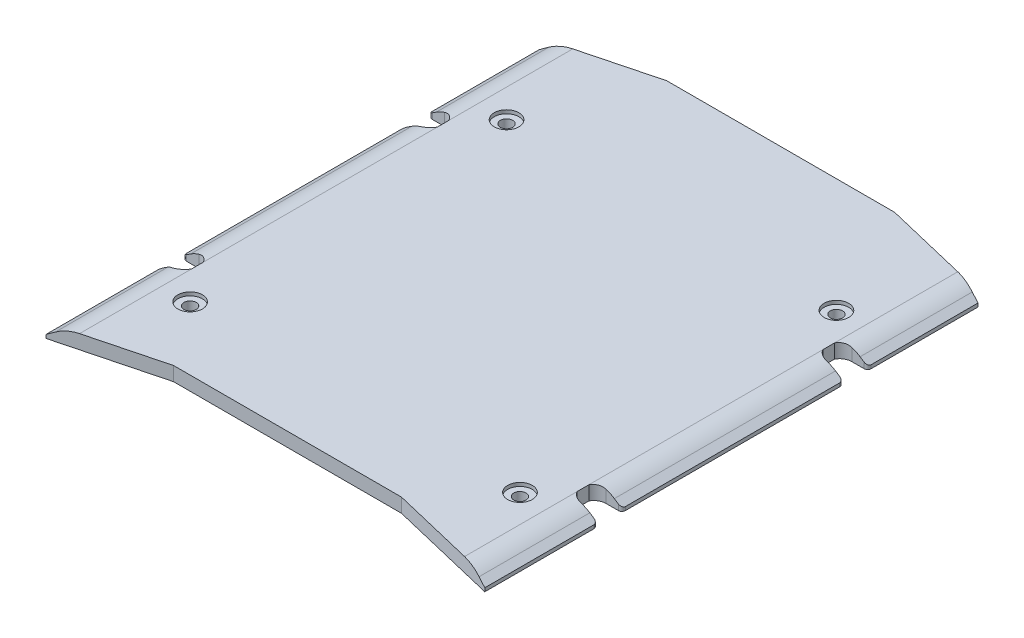
from build123d import *

# Parameters (mm, degrees)
BOSS_EXTRUDE1_DEPTH    = 148
FILLET1_R              = 10
CUT_EXTRUDE1_DEPTH     = 10
CUT_EXTRUDE2_START     = -4
CUT_EXTRUDE2_OUTLINE_R = 1.75
CUT_EXTRUDE2_DEPTH     = 4
SKETCH4_R              = 3.5
CUT_EXTRUDE3_DEPTH     = 1
FILLET2_R              = 1


# Read off the part's stored shape, not the designer's step: Cut-Extrude2
with BuildPart() as part:
    # Sketch1 → Boss-Extrude1 (new body)
    with BuildSketch(Plane.XY):
        Polygon((57.875, 15), (-57.875, 15), (-62.5, 12), (-62.5, 11), (62.5, 11), (62.5, 12), align=None)
    extrude(amount=BOSS_EXTRUDE1_DEPTH)

    # Fillet1
    fillet1_edges = [part.edges().sort_by_distance(p)[0] for p in [
        (-57.875, 15, 74),
        (57.875, 15, 74),
    ]]
    fillet(fillet1_edges, radius=FILLET1_R)

    # Sketch2 → Cut-Extrude1 (cut)
    with BuildSketch(Plane(origin=(0, 15, 0), x_dir=(1, 0, 0), z_dir=(0, 1, 0))):
        Polygon((-62.5, -7.5), (-33.66084425, 0), (31.256498232, 0), (62.5, -7.5), (62.5, 0), (31.256498232, 7.5), (-33.66084425, 7.5), (-62.5, 0), align=None)
        Polygon((31.256498232, -148), (62.5, -155.5), (62.5, -148), (31.256498232, -140.5), (-33.66084425, -140.5), (-62.5, -148), (-62.5, -155.5), (-33.66084425, -148), align=None)
    extrude(amount=-CUT_EXTRUDE1_DEPTH, mode=Mode.SUBTRACT)

    # Cut-Extrude2 outline → Cut-Extrude2 (cut)
    with BuildSketch(Plane(origin=(0, 15, 0), x_dir=(1, 0, 0), z_dir=(0, 1, 0)).offset(CUT_EXTRUDE2_START)):
        with BuildLine():
            Line((-62.5, -38.943696852), (-62.5, -45.943696852))
            Line((-62.5, -45.943696852), (-57.999999085, -45.943696852))
            ThreePointArc((-57.999999085, -45.943696852), (-56.202906175, -45.447104429), (-54.915769107, -44.098243751))
            Line((-54.915769107, -44.098243751), (-54.915769107, -40.789149953))
            ThreePointArc((-54.915769107, -40.789149953), (-56.202906175, -39.440289275), (-57.999999085, -38.943696852))
            Line((-57.999999085, -38.943696852), (-62.5, -38.943696852))
        make_face()
        with BuildLine():
            Line((-62.5, -115.432850877), (-59.820701756, -115.432850877))
            ThreePointArc((-59.820701756, -115.432850877), (-57.081076151, -115.820911776), (-54.915769107, -114.098243751))
            Line((-54.915769107, -114.098243751), (-54.915769107, -110.789149953))
            ThreePointArc((-54.915769107, -110.789149953), (-56.202906175, -109.440289275), (-57.999999085, -108.943696852))
            Line((-57.999999085, -108.943696852), (-62.5, -108.943696852))
            Line((-62.5, -108.943696852), (-62.5, -115.432850877))
        make_face()
        with BuildLine():
            Line((57.999999085, -45.943696852), (62.5, -45.943696852))
            Line((62.5, -45.943696852), (62.5, -38.943696852))
            Line((62.5, -38.943696852), (57.999999085, -38.943696852))
            ThreePointArc((57.999999085, -38.943696852), (56.202906175, -39.440289275), (54.915769107, -40.789149953))
            Line((54.915769107, -40.789149953), (54.915769107, -44.098243751))
            ThreePointArc((54.915769107, -44.098243751), (56.202906175, -45.447104429), (57.999999085, -45.943696852))
        make_face()
        with BuildLine():
            Line((62.5, -108.943696852), (57.999999085, -108.943696852))
            ThreePointArc((57.999999085, -108.943696852), (56.202906175, -109.440289275), (54.915769107, -110.789149953))
            Line((54.915769107, -110.789149953), (54.915769107, -114.098243751))
            ThreePointArc((54.915769107, -114.098243751), (56.202906175, -115.447104429), (57.999999085, -115.943696852))
            Line((57.999999085, -115.943696852), (62.5, -115.943696852))
            Line((62.5, -115.943696852), (62.5, -108.943696852))
        make_face()
        with Locations((47.15, -32.480990458)):
            Circle(CUT_EXTRUDE2_OUTLINE_R)
        with Locations((-47, -122.447604366)):
            Circle(CUT_EXTRUDE2_OUTLINE_R)
        with Locations((46.999994071, -122.480990458)):
            Circle(CUT_EXTRUDE2_OUTLINE_R)
        with Locations((-46.85, -32.447604366)):
            Circle(CUT_EXTRUDE2_OUTLINE_R)
    extrude(amount=CUT_EXTRUDE2_DEPTH, mode=Mode.SUBTRACT)

    # Sketch4 → Cut-Extrude3 (cut)
    with BuildSketch(Plane(origin=(0, 15, 0), x_dir=(1, 0, 0), z_dir=(0, 1, 0))):
        with Locations(Location((-46.85, -32.447604366, 0), (0, 0, 270))):
            Circle(SKETCH4_R)
        with Locations(Location((47.15, -32.480990458, 0), (0, 0, 270))):
            Circle(SKETCH4_R)
        with Locations(Location((-47, -122.447604366, 0), (0, 0, 270))):
            Circle(SKETCH4_R)
        with Locations(Location((46.999994071, -122.480990458, 0), (0, 0, 270))):
            Circle(SKETCH4_R)
    extrude(amount=-CUT_EXTRUDE3_DEPTH, mode=Mode.SUBTRACT)

    # Fillet2
    fillet2_edges = [part.edges().sort_by_distance(p)[0] for p in [
        (62.5, 11.5, 115.943696852),
        (62.5, 11.5, 108.943696852),
        (-62.5, 11.5, 45.943696852),
        (-62.5, 11.5, 38.943696852),
        (-62.5, 11.5, 115.432850877),
        (-62.5, 11.5, 108.943696852),
        (62.5, 11.5, 45.943696852),
        (62.5, 11.5, 38.943696852),
    ]]
    fillet(fillet2_edges, radius=FILLET2_R)


solid = part.part
